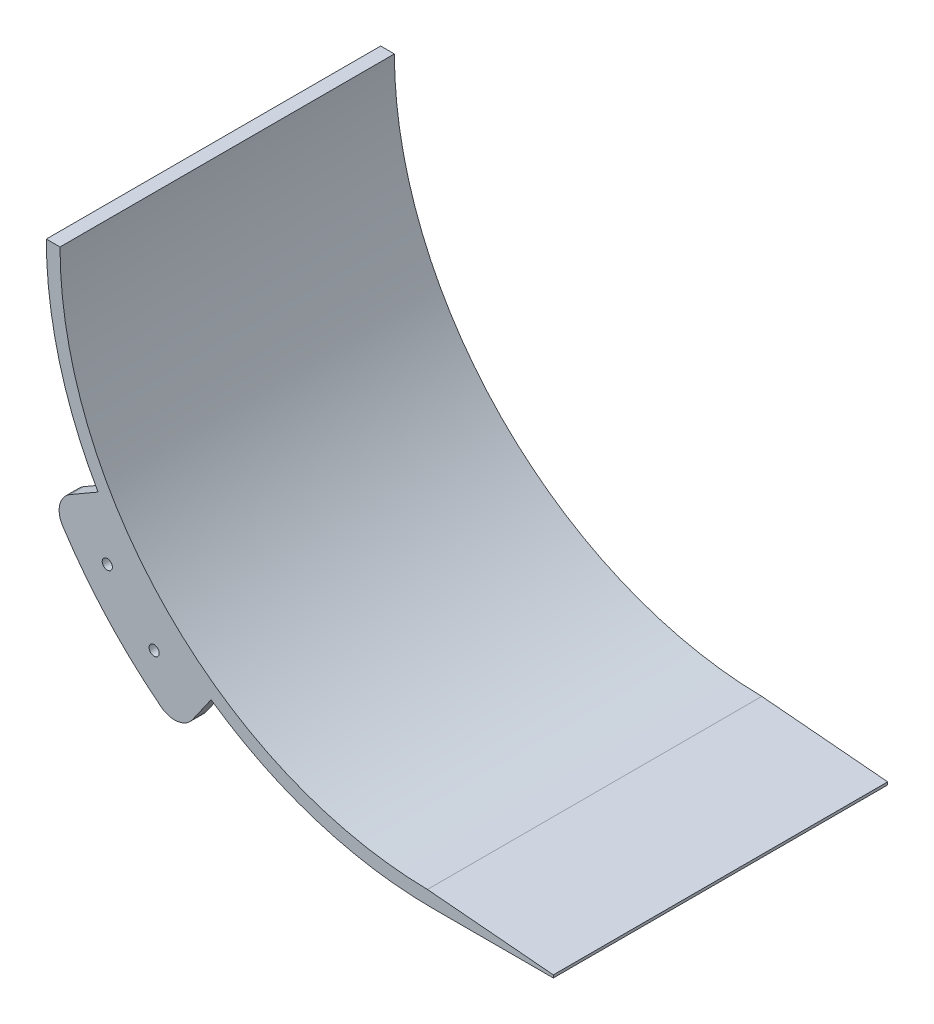
from build123d import *

# Parameters (mm, degrees)
BOSS_EXTRUDE1_DEPTH = 77.47
BOSS_EXTRUDE2_DEPTH = 6.35
SKETCH3_R           = 2.3495
CUT_EXTRUDE2_DEPTH  = 297.881345658
CHAMFER1_START      = -172.258951726
CHAMFER1_OUTLINE_W  = 62
CHAMFER1_OUTLINE_H  = 158
CHAMFER1_DEPTH      = 6.258951726


with BuildPart() as part:
    # Sketch1 → Boss-Extrude1 (new, symmetric)
    with BuildSketch(Plane.XY):
        with BuildLine():
            Line((-179.07, 0), (-172.72, 0))
            ThreePointArc((-172.72, 0), (-122.131483247, -122.131483247), (0, -172.72))
            Line((0, -172.72), (55.88, -172.72))
            Line((55.88, -172.72), (55.88, -179.07))
            Line((55.88, -179.07), (0, -179.07))
            ThreePointArc((0, -179.07), (-126.621611307, -126.621611307), (-179.07, 0))
        make_face()
    extrude(amount=BOSS_EXTRUDE1_DEPTH, both=True)

    # Sketch2 → Boss-Extrude2 (add)
    with BuildSketch(Plane.XY.offset(77.47)):
        with BuildLine():
            Line((-155.079169056, -89.535), (-168.047204306, -97.022098643))
            ThreePointArc((-168.047204306, -97.022098643), (-172.846425248, -103.448872568), (-171.488365315, -111.354036575))
            ThreePointArc((-171.488365315, -111.354036575), (-150.751097058, -138.137929751), (-125.876496699, -161.130656546))
            ThreePointArc((-125.876496699, -161.130656546), (-118.11977695, -163.172529091), (-111.299179173, -158.951700888))
            Line((-111.299179173, -158.951700888), (-102.710332457, -146.685556571))
            ThreePointArc((-102.710332457, -146.685556571), (-132.024252703, -120.977938478), (-155.079169056, -89.535))
        make_face()
    boss_extrude2 = extrude(amount=-BOSS_EXTRUDE2_DEPTH)

    # Mirror1: Boss-Extrude2 across plane
    add(boss_extrude2.mirror(Plane.XY))

    # Sketch3 → Cut-Extrude2 (cut, through all)
    with BuildSketch(Plane.XY.offset(77.47)):
        with Locations((-150.804793508, -116.396581802)):
            Circle(SKETCH3_R)
        with Locations((-129.097161455, -140.086305199)):
            Circle(SKETCH3_R)
    extrude(amount=-CUT_EXTRUDE2_DEPTH, mode=Mode.SUBTRACT)

    # Chamfer1: read off the stored shape, not the designer's step
    # Chamfer1 outline → Chamfer1 (cut)
    with BuildSketch(Plane(origin=(0, 0, 0), x_dir=(0.996185998135626, -0.0872551266031199, 0), z_dir=(0.0872551266031199, 0.996185998135626, 0)).offset(CHAMFER1_START)):
        with Locations((42, 0)):
            Rectangle(CHAMFER1_OUTLINE_W, CHAMFER1_OUTLINE_H)
    extrude(amount=CHAMFER1_DEPTH, mode=Mode.SUBTRACT)


solid = part.part
